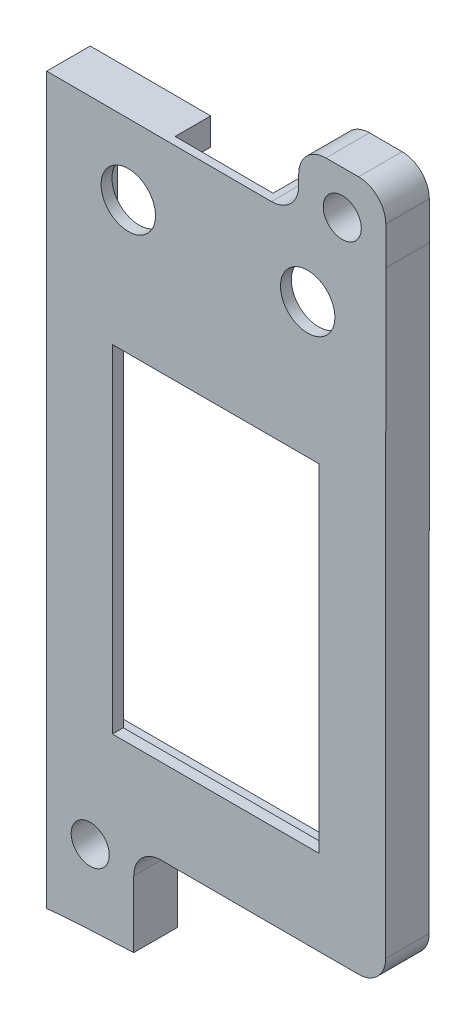
from build123d import *

# Parameters (mm, degrees)
SKETCH1_R           = 1.75
BOSS_EXTRUDE1_DEPTH = 1
SKETCH2_R           = 1.75
BOSS_EXTRUDE2_DEPTH = 2
SKETCH3_R           = 2.5
SKETCH3_R_2         = 1.75
SKETCH3_W           = 19
SKETCH3_H           = 31
BOSS_EXTRUDE3_DEPTH = 1
SKETCH5_W           = 3.6
SKETCH5_H           = 4.6
CUT_EXTRUDE1_DEPTH  = 21
SKETCH6_W           = 8.995193627
SKETCH6_H           = 3.264834395
CUT_EXTRUDE2_DEPTH  = 21


with BuildPart() as part:
    # Sketch1 → Boss-Extrude1 (new body)
    with BuildSketch(Plane.XY):
        with BuildLine():
            Line((-4.173686267, 14.847766361), (13.97122522, 14.82972857))
            ThreePointArc((13.97122522, 14.82972857), (15.740392314, 15.560875949), (16.473710392, 17.329144394))
            Line((16.473710392, 17.329144394), (16.486530072, 72.307640303))
            Line((16.486530072, 72.307640303), (16.486530072, 75.807640303))
            ThreePointArc((16.486530072, 75.807640303), (15.754297025, 77.575407256), (13.986530072, 78.307640303))
            Line((13.986530072, 78.307640303), (10.986530072, 78.307640303))
            ThreePointArc((10.986530072, 78.307640303), (9.218763119, 77.575407256), (8.486530072, 75.807640303))
            Line((8.486530072, 75.807640303), (8.486530072, 74.834217182))
            ThreePointArc((8.486530072, 74.834217182), (7.752059064, 73.064215098), (5.980204169, 72.334225186))
            Line((5.980204169, 72.334225186), (-14.676171507, 72.386493441))
            Line((-14.676171507, 72.386493441), (-14.676171507, 5.737899634))
            add(Edge.make_bspline(
                [(-14.676171507, 5.737899634), (-14.011850481, 5.817020009), (-13.346323065, 5.876368565), (-12.012830027, 5.955105359), (-11.346034693, 5.993673711), (-9.345364589, 6.104722571), (-8.011220337, 6.17278648), (-6.676171507, 6.226025038)],
                knots=[0, 0, 0, 0, 0.25, 0.25, 0.5, 0.5, 1, 1, 1, 1], degree=3))
            Line((-6.676171507, 6.226025038), (-6.676171507, 12.347767597))
            ThreePointArc((-6.676171507, 12.347767597), (-5.943059576, 14.116412996), (-4.173686267, 14.847766361))
        make_face()
        with Locations((12.486998677, 74.317766997)):
            Circle(SKETCH1_R, mode=Mode.SUBTRACT)
        with Locations((-10.676171507, 12.854229471)):
            Circle(SKETCH1_R, mode=Mode.SUBTRACT)
        Polygon((-12.176171507, 17.355722839), (13.97371046, 17.329727334), (13.985948537, 69.813959694), (-12.176171507, 69.880159515), align=None, mode=Mode.SUBTRACT)
    extrude(amount=BOSS_EXTRUDE1_DEPTH)

    # Sketch2 → Boss-Extrude2 (add)
    with BuildSketch(Plane.XY.offset(1)):
        with BuildLine():
            Line((-4.173686267, 14.847766361), (13.97122522, 14.82972857))
            ThreePointArc((13.97122522, 14.82972857), (15.740392314, 15.560875949), (16.473710392, 17.329144394))
            Line((16.473710392, 17.329144394), (16.486530072, 72.307640303))
            Line((16.486530072, 72.307640303), (16.486530072, 75.807640303))
            ThreePointArc((16.486530072, 75.807640303), (15.754297025, 77.575407256), (13.986530072, 78.307640303))
            Line((13.986530072, 78.307640303), (10.986530072, 78.307640303))
            ThreePointArc((10.986530072, 78.307640303), (9.218763119, 77.575407256), (8.486530072, 75.807640303))
            Line((8.486530072, 75.807640303), (8.486530072, 74.834217182))
            ThreePointArc((8.486530072, 74.834217182), (7.752059064, 73.064215098), (5.980204169, 72.334225186))
            Line((5.980204169, 72.334225186), (-14.676171507, 72.386493441))
            Line((-14.676171507, 72.386493441), (-14.676171507, 5.737899634))
            add(Edge.make_bspline(
                [(-14.676171507, 5.737899634), (-14.011850481, 5.817020009), (-13.346323065, 5.876368565), (-12.012830027, 5.955105359), (-11.346034693, 5.993673711), (-9.345364589, 6.104722571), (-8.011220337, 6.17278648), (-6.676171507, 6.226025038)],
                knots=[0, 0, 0, 0, 0.25, 0.25, 0.5, 0.5, 1, 1, 1, 1], degree=3))
            Line((-6.676171507, 6.226025038), (-6.676171507, 12.347767597))
            ThreePointArc((-6.676171507, 12.347767597), (-5.943059576, 14.116412996), (-4.173686267, 14.847766361))
        make_face()
        with Locations((12.486998677, 74.317766997)):
            Circle(SKETCH2_R, mode=Mode.SUBTRACT)
        with Locations((-10.676171507, 12.854229471)):
            Circle(SKETCH2_R, mode=Mode.SUBTRACT)
        Polygon((-12.176171507, 21.330224514), (13.974643281, 21.330224514), (13.985948537, 69.813959694), (-12.176171507, 69.880159515), align=None, mode=Mode.SUBTRACT)
    extrude(amount=BOSS_EXTRUDE2_DEPTH)

    # Sketch3 → Boss-Extrude3 (add)
    with BuildSketch(Plane.XY.offset(3)):
        with BuildLine():
            Line((-4.173686267, 14.847766361), (13.97122522, 14.82972857))
            ThreePointArc((13.97122522, 14.82972857), (15.740392314, 15.560875949), (16.473710392, 17.329144394))
            Line((16.473710392, 17.329144394), (16.486530072, 72.307640303))
            Line((16.486530072, 72.307640303), (16.486530072, 75.807640303))
            ThreePointArc((16.486530072, 75.807640303), (15.754297025, 77.575407256), (13.986530072, 78.307640303))
            Line((13.986530072, 78.307640303), (10.986530072, 78.307640303))
            ThreePointArc((10.986530072, 78.307640303), (9.218763119, 77.575407256), (8.486530072, 75.807640303))
            Line((8.486530072, 75.807640303), (8.486530072, 74.834217182))
            ThreePointArc((8.486530072, 74.834217182), (7.752059064, 73.064215098), (5.980204169, 72.334225186))
            Line((5.980204169, 72.334225186), (-14.676171507, 72.386493441))
            Line((-14.676171507, 72.386493441), (-14.676171507, 5.737899634))
            add(Edge.make_bspline(
                [(-14.676171507, 5.737899634), (-14.011850481, 5.817020009), (-13.346323065, 5.876368565), (-12.012830027, 5.955105359), (-11.346034693, 5.993673711), (-9.345364589, 6.104722571), (-8.011220337, 6.17278648), (-6.676171507, 6.226025038)],
                knots=[0, 0, 0, 0, 0.25, 0.25, 0.5, 0.5, 1, 1, 1, 1], degree=3))
            Line((-6.676171507, 6.226025038), (-6.676171507, 12.347767597))
            ThreePointArc((-6.676171507, 12.347767597), (-5.943059576, 14.116412996), (-4.173686267, 14.847766361))
        make_face()
        with Locations((-7.177066698, 65.873523259)):
            Circle(SKETCH3_R, mode=Mode.SUBTRACT)
        with Locations((9.307529554, 66.02592423)):
            Circle(SKETCH3_R, mode=Mode.SUBTRACT)
        with Locations((12.486998677, 74.317766997)):
            Circle(SKETCH3_R_2, mode=Mode.SUBTRACT)
        with Locations((-10.676171507, 12.854229471)):
            Circle(SKETCH3_R_2, mode=Mode.SUBTRACT)
        with Locations((0.861995575, 38.14822724)):
            Rectangle(SKETCH3_W, SKETCH3_H, mode=Mode.SUBTRACT)
    extrude(amount=BOSS_EXTRUDE3_DEPTH)

    # Sketch5 → Cut-Extrude1 (cut)
    with BuildSketch(Plane.ZY.offset(14.676171507)):
        with Locations((0.78983946, 57.439422967)):
            Rectangle(SKETCH5_W, SKETCH5_H)
    extrude(amount=-CUT_EXTRUDE1_DEPTH, mode=Mode.SUBTRACT)

    # Sketch6 → Cut-Extrude2 (cut)
    with BuildSketch(Plane(origin=(0.183069407, 72.348894077, 0), x_dir=(0.9999967986314592, -0.0025303610084290986, 0), z_dir=(0.002530361008429098, 0.9999967986314591, 0))):
        with Locations((0.710777389, -1.632417198)):
            Rectangle(SKETCH6_W, SKETCH6_H)
    extrude(amount=-CUT_EXTRUDE2_DEPTH, mode=Mode.SUBTRACT)


solid = part.part
